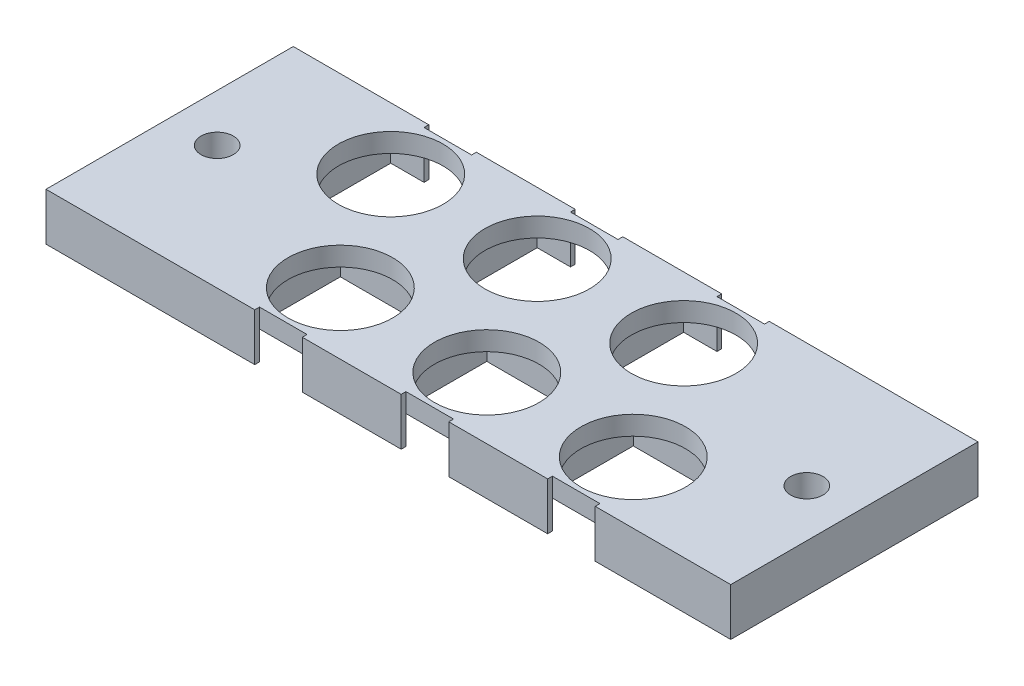
from build123d import *

# Parameters (mm, degrees)
SKETCH1_R               = 5.5
BOSS_EXTRUDE1_DEPTH     = 2
BOSS_EXTRUDE1_2_DEPTH   = 2
BOSS_EXTRUDE1_3_DEPTH   = 2
BOSS_EXTRUDE1_4_DEPTH   = 2
BOSS_EXTRUDE1_5_DEPTH   = 2
BOSS_EXTRUDE1_6_DEPTH   = 2
BOSS_EXTRUDE2_START     = -5
BOSS_EXTRUDE2_OUTLINE_R = 1.7
BOSS_EXTRUDE2_DEPTH     = 5
CUT_EXTRUDE1_DEPTH      = 1


# Read off the part's stored shape, not the designer's step: Boss-Extrude2
with BuildPart() as part:
    # Sketch1 → Boss-Extrude1 (new body)
    with BuildSketch(Plane(origin=(0, 0, 0), x_dir=(1, 0, 0), z_dir=(0, 1, 0))):
        Polygon((3.686387934, -16.664883738), (3.686388262, -4.664883738), (-8.313611738, -4.66488341), (-8.313612066, -16.66488341), align=None)
        with Locations(Location((-2.313611902, -10.664883574, 0), (0, 0, 270))):
            Circle(SKETCH1_R, mode=Mode.SUBTRACT)
    extrude(amount=-BOSS_EXTRUDE1_DEPTH)



with BuildPart() as body_2:
    # Sketch1 → Boss-Extrude1 2 (new body)
    with BuildSketch(Plane(origin=(0, 0, 0), x_dir=(1, 0, 0), z_dir=(0, 1, 0))):
        Polygon((19.086387939, -16.664884095), (19.086388267, -4.664884095), (7.086388267, -4.664883767), (7.086387939, -16.664883767), align=None)
        with Locations(Location((13.086388103, -10.664883931, 0), (0, 0, 270))):
            Circle(SKETCH1_R, mode=Mode.SUBTRACT)
    extrude(amount=-BOSS_EXTRUDE1_2_DEPTH)


with BuildPart() as body_3:
    # Sketch1 → Boss-Extrude1 3 (new body)
    with BuildSketch(Plane(origin=(0, 0, 0), x_dir=(1, 0, 0), z_dir=(0, 1, 0))):
        Polygon((34.486387949, -16.66488445), (34.486388277, -4.66488445), (22.486388277, -4.664884122), (22.486387949, -16.664884122), align=None)
        with Locations(Location((28.486388113, -10.664884286, 0), (0, 0, 270))):
            Circle(SKETCH1_R, mode=Mode.SUBTRACT)
    extrude(amount=-BOSS_EXTRUDE1_3_DEPTH)


with BuildPart() as body_4:
    # Sketch1 → Boss-Extrude1 4 (new body)
    with BuildSketch(Plane(origin=(0, 0, 0), x_dir=(1, 0, 0), z_dir=(0, 1, 0))):
        Polygon((14.786387887, -17.664883977), (14.786387559, -29.664883977), (26.786387559, -29.664884305), (26.786387887, -17.664884305), align=None)
        with Locations(Location((20.786387723, -23.664884141, 0), (0, 0, 270))):
            Circle(SKETCH1_R, mode=Mode.SUBTRACT)
    extrude(amount=-BOSS_EXTRUDE1_4_DEPTH)


with BuildPart() as body_5:
    # Sketch1 → Boss-Extrude1 5 (new body)
    with BuildSketch(Plane(origin=(0, 0, 0), x_dir=(1, 0, 0), z_dir=(0, 1, 0))):
        Polygon((30.186386338, -17.664884333), (30.18638601, -29.664884333), (42.18638601, -29.664884661), (42.186386338, -17.664884661), align=None)
        with Locations(Location((36.186386174, -23.664884497, 0), (0, 0, 270))):
            Circle(SKETCH1_R, mode=Mode.SUBTRACT)
    extrude(amount=-BOSS_EXTRUDE1_5_DEPTH)


with BuildPart() as body_6:
    # Sketch1 → Boss-Extrude1 6 (new body)
    with BuildSketch(Plane(origin=(0, 0, 0), x_dir=(1, 0, 0), z_dir=(0, 1, 0))):
        Polygon((-0.613612103, -17.664883618), (-0.613612431, -29.664883618), (11.386387569, -29.664883947), (11.386387897, -17.664883947), align=None)
        with Locations(Location((5.386387733, -23.664883782, 0), (0, 0, 270))):
            Circle(SKETCH1_R, mode=Mode.SUBTRACT)
    extrude(amount=-BOSS_EXTRUDE1_6_DEPTH)


with BuildPart() as part_1:
    add(part.part)

    add(body_2.part)  # Boss-Extrude2 merges body 2

    add(body_3.part)  # Boss-Extrude2 merges body 3

    add(body_4.part)  # Boss-Extrude2 merges body 4

    add(body_5.part)  # Boss-Extrude2 merges body 5

    add(body_6.part)  # Boss-Extrude2 merges body 6
    # Boss-Extrude2 outline → Boss-Extrude2 (add)
    with BuildSketch(Plane(origin=(0, 0, 0), x_dir=(1, 0, 0), z_dir=(0, 1, 0)).offset(BOSS_EXTRUDE2_START)):
        Polygon((11.386387569, -29.664883947), (7.886387562, -29.664883851), (7.886387555, -30.164883851), (18.286387545, -30.164884073), (18.286387559, -29.664884073), (14.786387559, -29.664883977), (14.786387887, -17.664883977), (26.786387887, -17.664884305), (26.786387559, -29.664884305), (23.286387552, -29.66488421), (23.286387545, -30.16488421), (33.686385997, -30.164884494), (33.68638601, -29.664884428), (30.18638601, -29.664884333), (30.186386338, -17.664884333), (42.186386338, -17.664884661), (42.18638601, -29.664884661), (38.686386004, -29.664884565), (38.686385997, -30.164884565), (52.936387554, -30.164884954), (52.936388265, -4.164885084), (30.986388291, -4.164884354), (30.986388277, -4.664884354), (34.486388277, -4.66488445), (34.486387949, -16.66488445), (22.486387949, -16.664884122), (22.486388277, -4.664884122), (25.986388284, -4.664884218), (25.986388291, -4.164884218), (15.586388281, -4.164884108), (15.586388267, -4.664883999), (19.086388267, -4.664884095), (19.086387939, -16.664884095), (7.086387939, -16.664883767), (7.086388267, -4.664883767), (10.586388274, -4.664883862), (10.586388281, -4.164883862), (0.186388276, -4.164883578), (0.186388262, -4.664883642), (3.686388262, -4.664883738), (3.686387934, -16.664883738), (-8.313612066, -16.66488341), (-8.313611738, -4.66488341), (-4.813611731, -4.664883505), (-4.813611724, -4.164883505), (-19.063611735, -4.164883116), (-19.063612446, -30.164883114), (2.886387555, -30.164883714), (2.886387569, -29.664883714), (-0.613612431, -29.664883618), (-0.613612103, -17.664883618), (11.386387897, -17.664883947), align=None)
        with Locations((47.93638791, -17.164884883)):
            Circle(BOSS_EXTRUDE2_OUTLINE_R, mode=Mode.SUBTRACT)
        with Locations((-14.06361209, -17.164883252)):
            Circle(BOSS_EXTRUDE2_OUTLINE_R, mode=Mode.SUBTRACT)
    extrude(amount=BOSS_EXTRUDE2_DEPTH)

    # Sketch2 → Cut-Extrude1 (cut)
    # profile 1 of 2: a face of its own
    with BuildSketch(Plane(origin=(0, -5, 0), x_dir=(-1, 0, 0), z_dir=(0, -1, 0))):
        Polygon((6.544081332, -23.739762668), (8.090876204, -23.739762668), (8.090876204, -24.065403693), (6.829017229, -24.065403693), (6.829017229, -25.04232677), (8.090876204, -25.04232677), (8.090876204, -25.367967796), (6.829017229, -25.367967796), (6.829017229, -26.914762668), (6.544081332, -26.914762668), align=None)
    # profile 2 of 2: a face of its own
    with BuildSketch(Plane(origin=(0, -5, 0), x_dir=(-1, 0, 0), z_dir=(0, -1, 0))):
        Polygon((10.108960138, -23.658352411), (10.166837742, -23.658352411), (10.166837742, -25.856429335), (10.533183896, -25.856429335), (10.533183896, -26.18207036), (10.166837742, -26.18207036), (10.166837742, -26.914762668), (9.881901845, -26.914762668), (9.881901845, -26.18207036), (8.375812101, -26.18207036), align=None)
        Polygon((9.881901845, -25.856429335), (9.881901845, -24.478815152), (8.936143631, -25.856429335), align=None, mode=Mode.SUBTRACT)
    extrude(amount=-CUT_EXTRUDE1_DEPTH, mode=Mode.SUBTRACT)


solid = part_1.part
